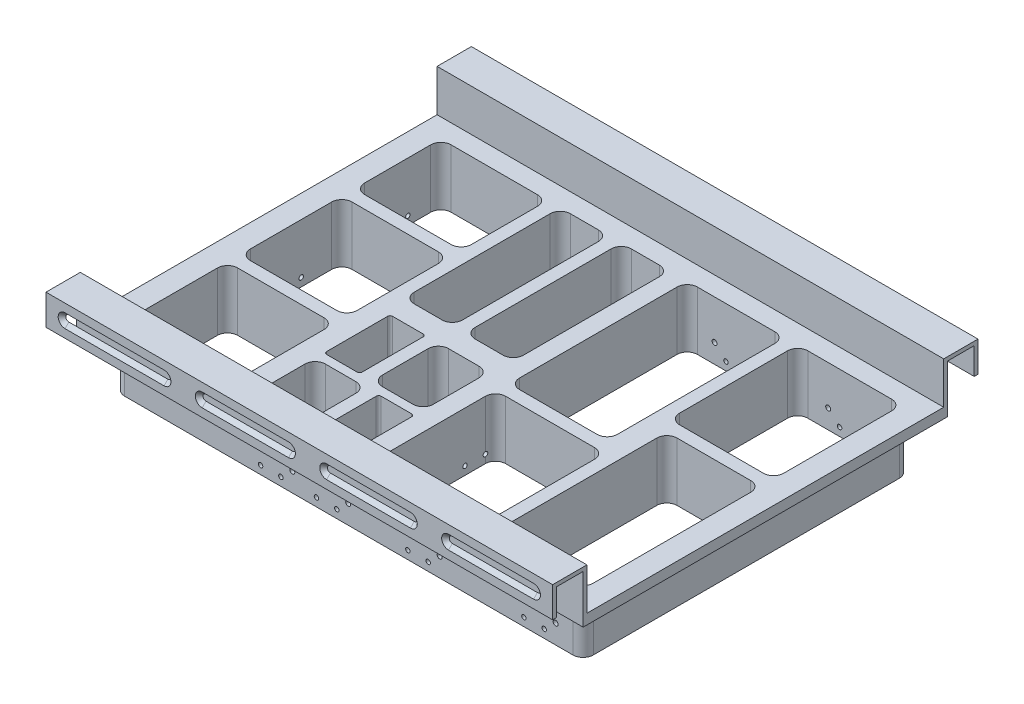
from build123d import *

# Parameters (mm, degrees)
SKETCH1_W                  = 399
SKETCH1_H                  = 287
BOSS_EXTRUDE1_DEPTH        = 53
SKETCH3_OUTSIDE_W          = 499.87
SKETCH3_OUTSIDE_H          = 387.87
SKETCH3_OUTSIDE_W_2        = 369
SKETCH3_OUTSIDE_H_2        = 257
CUT_EXTRUDE2_DEPTH         = 45
MINI_BIN_CUTS_DEPTH        = 46
FILLET1_R                  = 8
SKETCH6_W                  = 257
SKETCH6_H                  = 7
CUT_EXTRUDE5_DEPTH         = 414.348823634
SKETCH7_R                  = 1.75
SKETCH7_R_2                = 1.95
HOLES_LIDS_1_2_3_DEPTH     = 3
SKETCH8_R                  = 1.75
SKETCH8_R_2                = 1.95
HOLES_LIDS_8_9_12_13_DEPTH = 3
SKETCH9_R                  = 1.75
SKETCH9_R_2                = 1.95
HOLES_LIDS_4_5_10_11_DEPTH = 3
HOLE_LID_7_REACH           = 256.185
SKETCH11_R                 = 1.75
HOLE_START                 = -15
SKETCH12_R                 = 1.75
HOLE_LID_6_DEPTH           = 15
BOSS_EXTRUDE3_DEPTH        = 399
CUT_EXTRUDE6_DEPTH         = 10
CHAMFER1_SIZE              = 3
SKETCH13_R                 = 1.95
SERVO_BRACKETS_6_7_DEPTH   = 15
CHAMFER2_SIZE              = 3


with BuildPart() as part:
    # Sketch1 → Boss-Extrude1 (new body)
    with BuildSketch(Plane(origin=(0, 0, 0), x_dir=(1, 0, 0), z_dir=(0, 1, 0))):
        Rectangle(SKETCH1_W, SKETCH1_H)
    extrude(amount=BOSS_EXTRUDE1_DEPTH)

    # Sketch3 outside → Cut-Extrude2 (cut)
    with BuildSketch(Plane(origin=(0, 0, 0), x_dir=(-1, 0, 0), z_dir=(0, -1, 0))):
        Rectangle(SKETCH3_OUTSIDE_W, SKETCH3_OUTSIDE_H)
        Rectangle(SKETCH3_OUTSIDE_W_2, SKETCH3_OUTSIDE_H_2, mode=Mode.SUBTRACT)
    extrude(amount=-CUT_EXTRUDE2_DEPTH, mode=Mode.SUBTRACT)

    # Sketch2 → Mini bin cuts (cut)
    with BuildSketch(Plane(origin=(0, 53, 0), x_dir=(1, 0, 0), z_dir=(0, 1, 0))):
        with BuildLine():
            Line((-173.5, -125.5), (-105.5, -125.5))
            ThreePointArc((-105.5, -125.5), (-99.843145751, -123.156854249), (-97.5, -117.5))
            Line((-97.5, -117.5), (-97.5, -50.5))
            ThreePointArc((-97.5, -50.5), (-99.843145751, -44.843145751), (-105.5, -42.5))
            Line((-105.5, -42.5), (-173.5, -42.5))
            ThreePointArc((-173.5, -42.5), (-179.156854249, -44.843145751), (-181.5, -50.5))
            Line((-181.5, -50.5), (-181.5, -117.5))
            ThreePointArc((-181.5, -117.5), (-179.156854249, -123.156854249), (-173.5, -125.5))
        make_face()
        with BuildLine():
            Line((-173.5, -32.5), (-105.5, -32.5))
            ThreePointArc((-105.5, -32.5), (-99.843145751, -30.156854249), (-97.5, -24.5))
            Line((-97.5, -24.5), (-97.5, 39.5))
            ThreePointArc((-97.5, 39.5), (-99.843145751, 45.156854249), (-105.5, 47.5))
            Line((-105.5, 47.5), (-173.5, 47.5))
            ThreePointArc((-173.5, 47.5), (-179.156854249, 45.156854249), (-181.5, 39.5))
            Line((-181.5, 39.5), (-181.5, -24.5))
            ThreePointArc((-181.5, -24.5), (-179.156854249, -30.156854249), (-173.5, -32.5))
        make_face()
        with BuildLine():
            Line((-173.5, 125.5), (-105.5, 125.5))
            ThreePointArc((-105.5, 125.5), (-99.843145751, 123.156854249), (-97.5, 117.5))
            Line((-97.5, 117.5), (-97.5, 65.5))
            ThreePointArc((-97.5, 65.5), (-99.843145751, 59.843145751), (-105.5, 57.5))
            Line((-105.5, 57.5), (-173.5, 57.5))
            ThreePointArc((-173.5, 57.5), (-179.156854249, 59.843145751), (-181.5, 65.5))
            Line((-181.5, 65.5), (-181.5, 117.5))
            ThreePointArc((-181.5, 117.5), (-179.156854249, 123.156854249), (-173.5, 125.5))
        make_face()
        with BuildLine():
            Line((173.5, -125.5), (115.5, -125.5))
            ThreePointArc((115.5, -125.5), (109.843145751, -123.156854249), (107.5, -117.5))
            Line((107.5, -117.5), (107.5, 6.5))
            ThreePointArc((107.5, 6.5), (109.843145751, 12.156854249), (115.5, 14.5))
            Line((115.5, 14.5), (173.5, 14.5))
            ThreePointArc((173.5, 14.5), (179.156854249, 12.156854249), (181.5, 6.5))
            Line((181.5, 6.5), (181.5, -117.5))
            ThreePointArc((181.5, -117.5), (179.156854249, -123.156854249), (173.5, -125.5))
        make_face()
        with BuildLine():
            Line((173.5, 125.5), (107.5, 125.5))
            ThreePointArc((107.5, 125.5), (101.843145751, 123.156854249), (99.5, 117.5))
            Line((99.5, 117.5), (99.5, 32.5))
            ThreePointArc((99.5, 32.5), (101.843145751, 26.843145751), (107.5, 24.5))
            Line((107.5, 24.5), (173.5, 24.5))
            ThreePointArc((173.5, 24.5), (179.156854249, 26.843145751), (181.5, 32.5))
            Line((181.5, 32.5), (181.5, 117.5))
            ThreePointArc((181.5, 117.5), (179.156854249, 123.156854249), (173.5, 125.5))
        make_face()
        with BuildLine():
            Line((81.5, 125.5), (20.5, 125.5))
            ThreePointArc((20.5, 125.5), (14.843145751, 123.156854249), (12.5, 117.5))
            Line((12.5, 117.5), (12.5, -6.5))
            ThreePointArc((12.5, -6.5), (14.843145751, -12.156854249), (20.5, -14.5))
            Line((20.5, -14.5), (81.5, -14.5))
            ThreePointArc((81.5, -14.5), (87.156854249, -12.156854249), (89.5, -6.5))
            Line((89.5, -6.5), (89.5, 117.5))
            ThreePointArc((89.5, 117.5), (87.156854249, 123.156854249), (81.5, 125.5))
        make_face()
        with BuildLine():
            Line((-9.5, 125.5), (-31.5, 125.5))
            ThreePointArc((-31.5, 125.5), (-37.156854249, 123.156854249), (-39.5, 117.5))
            Line((-39.5, 117.5), (-39.5, 10.5))
            ThreePointArc((-39.5, 10.5), (-37.156854249, 4.843145751), (-31.5, 2.5))
            Line((-31.5, 2.5), (-9.5, 2.5))
            ThreePointArc((-9.5, 2.5), (-3.843145751, 4.843145751), (-1.5, 10.5))
            Line((-1.5, 10.5), (-1.5, 117.5))
            ThreePointArc((-1.5, 117.5), (-3.843145751, 123.156854249), (-9.5, 125.5))
        make_face()
        with BuildLine():
            Line((-57.5, 125.5), (-79.5, 125.5))
            ThreePointArc((-79.5, 125.5), (-85.156854249, 123.156854249), (-87.5, 117.5))
            Line((-87.5, 117.5), (-87.5, 10.5))
            ThreePointArc((-87.5, 10.5), (-85.156854249, 4.843145751), (-79.5, 2.5))
            Line((-79.5, 2.5), (-57.5, 2.5))
            ThreePointArc((-57.5, 2.5), (-51.843145751, 4.843145751), (-49.5, 10.5))
            Line((-49.5, 10.5), (-49.5, 117.5))
            ThreePointArc((-49.5, 117.5), (-51.843145751, 123.156854249), (-57.5, 125.5))
        make_face()
        with BuildLine():
            Line((-79.5, -14.5), (-55.5, -14.5))
            ThreePointArc((-55.5, -14.5), (-54.085786438, -15.085786438), (-53.5, -16.5))
            Line((-53.5, -16.5), (-53.5, -64.5))
            ThreePointArc((-53.5, -64.5), (-54.085786438, -65.914213562), (-55.5, -66.5))
            Line((-55.5, -66.5), (-79.5, -66.5))
            ThreePointArc((-79.5, -66.5), (-80.914213562, -65.914213562), (-81.5, -64.5))
            Line((-81.5, -64.5), (-81.5, -16.5))
            ThreePointArc((-81.5, -16.5), (-80.914213562, -15.085786438), (-79.5, -14.5))
        make_face()
        with BuildLine():
            Line((-73.5, -125.5), (-49.5, -125.5))
            ThreePointArc((-49.5, -125.5), (-43.843145751, -123.156854249), (-41.5, -117.5))
            Line((-41.5, -117.5), (-41.5, -81.5))
            ThreePointArc((-41.5, -81.5), (-43.843145751, -75.843145751), (-49.5, -73.5))
            Line((-49.5, -73.5), (-73.5, -73.5))
            ThreePointArc((-73.5, -73.5), (-79.156854249, -75.843145751), (-81.5, -81.5))
            Line((-81.5, -81.5), (-81.5, -117.5))
            ThreePointArc((-81.5, -117.5), (-79.156854249, -123.156854249), (-73.5, -125.5))
        make_face()
        with BuildLine():
            Line((-35.5, -14.5), (-11.5, -14.5))
            ThreePointArc((-11.5, -14.5), (-5.843145751, -16.843145751), (-3.5, -22.5))
            Line((-3.5, -22.5), (-3.5, -58.5))
            ThreePointArc((-3.5, -58.5), (-5.843145751, -64.156854249), (-11.5, -66.5))
            Line((-11.5, -66.5), (-35.5, -66.5))
            ThreePointArc((-35.5, -66.5), (-41.156854249, -64.156854249), (-43.5, -58.5))
            Line((-43.5, -58.5), (-43.5, -22.5))
            ThreePointArc((-43.5, -22.5), (-41.156854249, -16.843145751), (-35.5, -14.5))
        make_face()
        with BuildLine():
            Line((-29.5, -73.5), (-5.5, -73.5))
            ThreePointArc((-5.5, -73.5), (-4.085786438, -74.085786438), (-3.5, -75.5))
            Line((-3.5, -75.5), (-3.5, -123.5))
            ThreePointArc((-3.5, -123.5), (-4.085786438, -124.914213562), (-5.5, -125.5))
            Line((-5.5, -125.5), (-29.5, -125.5))
            ThreePointArc((-29.5, -125.5), (-30.914213562, -124.914213562), (-31.5, -123.5))
            Line((-31.5, -123.5), (-31.5, -75.5))
            ThreePointArc((-31.5, -75.5), (-30.914213562, -74.085786438), (-29.5, -73.5))
        make_face()
        with BuildLine():
            Line((89.5, -125.5), (19.5, -125.5))
            ThreePointArc((19.5, -125.5), (13.843145751, -123.156854249), (11.5, -117.5))
            Line((11.5, -117.5), (11.5, -32.5))
            ThreePointArc((11.5, -32.5), (13.843145751, -26.843145751), (19.5, -24.5))
            Line((19.5, -24.5), (89.5, -24.5))
            ThreePointArc((89.5, -24.5), (95.156854249, -26.843145751), (97.5, -32.5))
            Line((97.5, -32.5), (97.5, -117.5))
            ThreePointArc((97.5, -117.5), (95.156854249, -123.156854249), (89.5, -125.5))
        make_face()
    extrude(amount=-MINI_BIN_CUTS_DEPTH, mode=Mode.SUBTRACT)

    # Fillet1
    fillet1_edges = [part.edges().sort_by_distance(p)[0] for p in [
        (184.5, 22.5, 128.5),
        (184.5, 22.5, -128.5),
        (-184.5, 22.5, -128.5),
        (-184.5, 22.5, 128.5),
    ]]
    fillet(fillet1_edges, radius=FILLET1_R)

    # Sketch6 → Cut-Extrude5 (cut, through all)
    with BuildSketch(Plane.ZY.offset(184.5)):
        with Locations((0, 3.5)):
            Rectangle(SKETCH6_W, SKETCH6_H)
    extrude(amount=-CUT_EXTRUDE5_DEPTH, mode=Mode.SUBTRACT)

    # Sketch7 → Holes Lids 1,2,3 (cut)
    with BuildSketch(Plane.ZY.offset(184.5)):
        with Locations((-99.5, 13.5)):
            Circle(SKETCH7_R)
        with Locations((-83.5, 13.5)):
            Circle(SKETCH7_R)
        with Locations((-15.5, 13.5)):
            Circle(SKETCH7_R)
        with Locations((76, 13.5)):
            Circle(SKETCH7_R)
        with Locations((0.5, 13.5)):
            Circle(SKETCH7_R)
        with Locations((92, 13.5)):
            Circle(SKETCH7_R)
        with Locations((-74.5, 21.963)):
            Circle(SKETCH7_R_2)
        with Locations((101, 21.963)):
            Circle(SKETCH7_R_2)
        with Locations((9.5, 21.963)):
            Circle(SKETCH7_R_2)
    extrude(amount=-HOLES_LIDS_1_2_3_DEPTH, mode=Mode.SUBTRACT)

    # Sketch8 → Holes Lids 8,9,12,13 (cut)
    with BuildSketch(Plane.XY.offset(128.5)):
        with Locations((-69.5, 13.5)):
            Circle(SKETCH8_R)
        with Locations((-25.5, 13.5)):
            Circle(SKETCH8_R)
        with Locations((46.5, 13.5)):
            Circle(SKETCH8_R)
        with Locations((137.896, 13.5)):
            Circle(SKETCH8_R)
        with Locations((153.896, 13.5)):
            Circle(SKETCH8_R)
        with Locations((62.5, 13.5)):
            Circle(SKETCH8_R)
        with Locations((-9.5, 13.5)):
            Circle(SKETCH8_R)
        with Locations((-53.5, 13.5)):
            Circle(SKETCH8_R)
        with Locations((-44.5, 21.96)):
            Circle(SKETCH8_R_2)
        with Locations((-0.5, 21.96)):
            Circle(SKETCH8_R_2)
        with Locations((71.5, 21.96)):
            Circle(SKETCH8_R_2)
        with Locations((162.896, 21.96)):
            Circle(SKETCH8_R_2)
    extrude(amount=-HOLES_LIDS_8_9_12_13_DEPTH, mode=Mode.SUBTRACT)

    # Sketch9 → Holes Lids 4,5,10,11 (cut)
    with BuildSketch(Plane(origin=(0, 0, -128.5), x_dir=(-1, 0, 0), z_dir=(0, 0, -1))):
        with Locations((-148.5, 13.5)):
            Circle(SKETCH9_R)
        with Locations((-59, 13.5)):
            Circle(SKETCH9_R)
        with Locations((12.5, 13.5)):
            Circle(SKETCH9_R)
        with Locations((60.5, 13.5)):
            Circle(SKETCH9_R)
        with Locations((-132.5, 13.5)):
            Circle(SKETCH9_R)
        with Locations((-43, 13.5)):
            Circle(SKETCH9_R)
        with Locations((28.5, 13.5)):
            Circle(SKETCH9_R)
        with Locations((76.5, 13.5)):
            Circle(SKETCH9_R)
        with Locations((-123.5, 21.96)):
            Circle(SKETCH9_R_2)
        with Locations((-34, 21.96)):
            Circle(SKETCH9_R_2)
        with Locations((37.5, 21.96)):
            Circle(SKETCH9_R_2)
        with Locations((85.5, 21.96)):
            Circle(SKETCH9_R_2)
    extrude(amount=-HOLES_LIDS_4_5_10_11_DEPTH, mode=Mode.SUBTRACT)

    # Sketch11 → Hole Lid 7 (cut, up to next)
    with BuildSketch(Plane.ZY.offset(3.5), mode=Mode.PRIVATE) as hole_lid_7_sk1:
        with Locations((32.5, 13.5)):
            Circle(SKETCH11_R)
    hole_lid_7_tool1 = extrude(hole_lid_7_sk1.sketch, amount=-HOLE_LID_7_REACH, mode=Mode.PRIVATE) & part.part
    # Sketch11 → Hole Lid 7 (cut, up to next)
    with BuildSketch(Plane.ZY.offset(3.5), mode=Mode.PRIVATE) as hole_lid_7_sk2:
        with Locations((48.5, 13.5)):
            Circle(SKETCH11_R)
    hole_lid_7_tool2 = extrude(hole_lid_7_sk2.sketch, amount=-HOLE_LID_7_REACH, mode=Mode.PRIVATE) & part.part
    add(hole_lid_7_tool1.solids().sort_by_distance((-3.5, 13.5, 32.5))[0], mode=Mode.SUBTRACT)
    add(hole_lid_7_tool2.solids().sort_by_distance((-3.5, 13.5, 48.5))[0], mode=Mode.SUBTRACT)

    # Sketch12 → Hole Lid 6 (cut)
    with BuildSketch(Plane(origin=(-81.5, 0, 0), x_dir=(0, 0, -1), z_dir=(1, 0, 0)).offset(HOLE_START)):
        with Locations(Location((-48.5, 13.5, 0), (0, 0, 180))):
            Circle(SKETCH12_R)
        with Locations(Location((-32.5, 13.5, 0), (0, 0, 180))):
            Circle(SKETCH12_R)
    extrude(amount=HOLE_LID_6_DEPTH, mode=Mode.SUBTRACT)

    # Sketch15 → Boss-Extrude3 (add)
    with BuildSketch(Plane.ZY.offset(199.5)):
        Polygon((143.5, 53), (143.5, 83), (164.5, 83), (164.5, 62), (167.5, 62), (167.5, 86), (140.5, 86), (140.5, 53), align=None)
        Polygon((-140.5, 53), (-143.5, 53), (-143.5, 83), (-164.5, 83), (-164.5, 62), (-167.5, 62), (-167.5, 86), (-140.5, 86), align=None)
    extrude(amount=-BOSS_EXTRUDE3_DEPTH)

    # Sketch16 → Cut-Extrude6 (cut)
    with BuildSketch(Plane.XY.offset(167.5)):
        with BuildLine():
            Line((-184.5, 76.4), (-106.5, 76.4))
            ThreePointArc((-106.5, 76.4), (-104.1, 74), (-106.5, 71.6))
            Line((-106.5, 71.6), (-184.5, 71.6))
            ThreePointArc((-184.5, 71.6), (-186.9, 74), (-184.5, 76.4))
        make_face()
        with BuildLine():
            Line((-76.5, 76.4), (-8.5, 76.4))
            ThreePointArc((-8.5, 76.4), (-6.1, 74), (-8.5, 71.6))
            Line((-8.5, 71.6), (-76.5, 71.6))
            ThreePointArc((-76.5, 71.6), (-78.9, 74), (-76.5, 76.4))
        make_face()
        with BuildLine():
            Line((21.5, 76.4), (87.5, 76.4))
            ThreePointArc((87.5, 76.4), (89.9, 74), (87.5, 71.6))
            Line((87.5, 71.6), (21.5, 71.6))
            ThreePointArc((21.5, 71.6), (19.1, 74), (21.5, 76.4))
        make_face()
        with BuildLine():
            Line((117.5, 76.4), (184.5, 76.4))
            ThreePointArc((184.5, 76.4), (186.9, 74), (184.5, 71.6))
            Line((184.5, 71.6), (117.5, 71.6))
            ThreePointArc((117.5, 71.6), (115.1, 74), (117.5, 76.4))
        make_face()
    cut_extrude6 = extrude(amount=-CUT_EXTRUDE6_DEPTH, mode=Mode.SUBTRACT)

    # Chamfer1
    chamfer1_edges = [part.edges().sort_by_distance(p)[0] for p in [
        (151, 71.6, 167.5),
        (186.9, 74, 167.5),
        (115.1, 74, 167.5),
        (151, 76.4, 167.5),
        (54.5, 71.6, 167.5),
        (89.9, 74, 167.5),
        (19.1, 74, 167.5),
        (54.5, 76.4, 167.5),
        (-42.5, 71.6, 167.5),
        (-6.1, 74, 167.5),
        (-78.9, 74, 167.5),
        (-42.5, 76.4, 167.5),
        (-145.5, 71.6, 167.5),
        (-104.1, 74, 167.5),
        (-186.9, 74, 167.5),
        (-145.5, 76.4, 167.5),
    ]]
    chamfer(chamfer1_edges, length=CHAMFER1_SIZE - 0.0001)  # a hair under: the kernel refuses the full size

    # Sketch13 → Servo brackets 6,7, (cut)
    with BuildSketch(Plane.XZ.offset(-7)):
        with Locations(Location((-88.5, 46.5, 0), (0, 0, 270))):
            Circle(SKETCH13_R)
        with Locations(Location((-88.5, 6.37, 0), (0, 0, 90))):
            Circle(SKETCH13_R)
        with Locations(Location((3.5, 17.84, 0), (0, 0, 270))):
            Circle(SKETCH13_R)
        with Locations(Location((3.5, 57.97, 0), (0, 0, 90))):
            Circle(SKETCH13_R)
    extrude(amount=-SERVO_BRACKETS_6_7_DEPTH, mode=Mode.SUBTRACT)

    # Mirror1: Cut-Extrude6 across plane
    add(cut_extrude6.mirror(Plane(origin=(0, 0, 0), x_dir=(1, 0, 0), z_dir=(0, 0, -1))), mode=Mode.SUBTRACT)

    # Chamfer2
    chamfer2_edges = [part.edges().sort_by_distance(p)[0] for p in [
        (-145.5, 76.4, -167.5),
        (-186.9, 74, -167.5),
        (-104.1, 74, -167.5),
        (-145.5, 71.6, -167.5),
        (-42.5, 76.4, -167.5),
        (-78.9, 74, -167.5),
        (-6.1, 74, -167.5),
        (-42.5, 71.6, -167.5),
        (54.5, 76.4, -167.5),
        (19.1, 74, -167.5),
        (89.9, 74, -167.5),
        (54.5, 71.6, -167.5),
        (151, 76.4, -167.5),
        (115.1, 74, -167.5),
        (186.9, 74, -167.5),
        (151, 71.6, -167.5),
    ]]
    chamfer(chamfer2_edges, length=CHAMFER2_SIZE - 0.0001)  # a hair under: the kernel refuses the full size


solid = part.part
